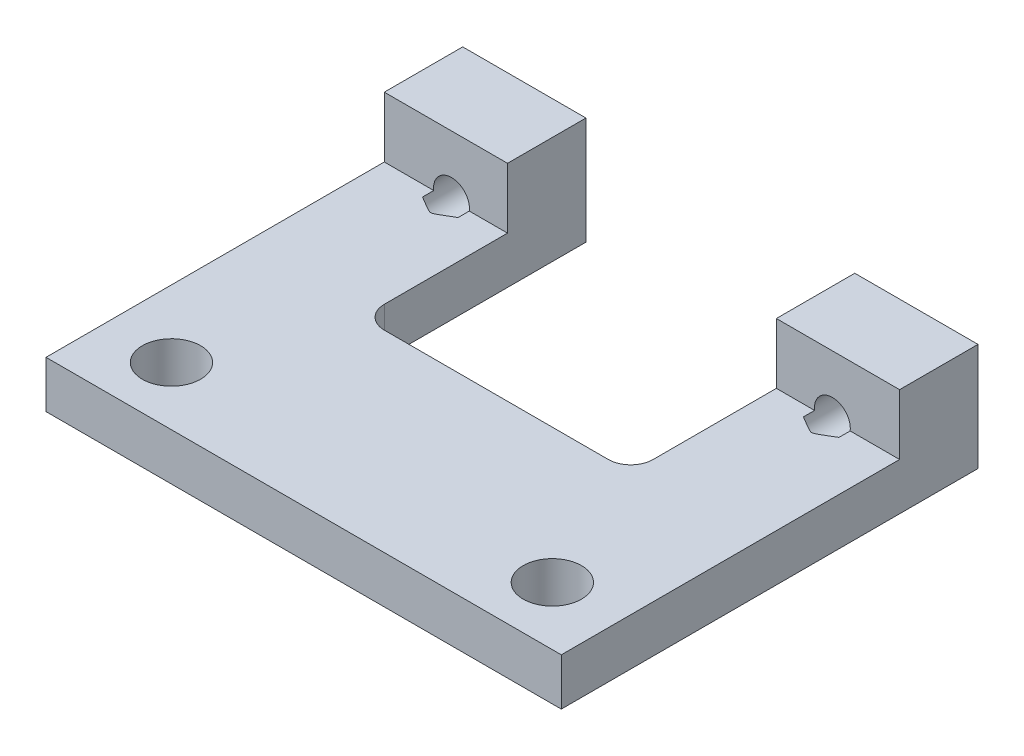
from build123d import *

# Parameters (mm, degrees)
SKETCH1_W                 = 23
SKETCH1_H                 = 18.6
BOSS_EXTRUDE1_DEPTH       = 4.8
SKETCH2_W                 = 15.1
SKETCH2_H                 = 2.7
CUT_EXTRUDE1_DEPTH        = 27.8
SKETCH3_W                 = 12
SKETCH3_H                 = 10
CUT_EXTRUDE2_DEPTH        = 27.8
M2X0_4_TAPPED_HOLE1_D     = 1.6
M2X0_4_TAPPED_HOLE1_DEPTH = 4
M2X0_4_TAPPED_HOLE1_TIP   = 0.480688495
SKETCH7_R                 = 1.3
CUT_EXTRUDE3_DEPTH        = 27.8
FILLET1_R                 = 1


with BuildPart() as part:
    # Sketch1 → Boss-Extrude1 (new body)
    with BuildSketch(Plane(origin=(0, 0, 0), x_dir=(1, 0, 0), z_dir=(0, 1, 0))):
        Rectangle(SKETCH1_W, SKETCH1_H)
    extrude(amount=BOSS_EXTRUDE1_DEPTH)

    # Sketch2 → Cut-Extrude1 (cut)
    with BuildSketch(Plane(origin=(11.5, 0, 0), x_dir=(0, 0, -1), z_dir=(1, 0, 0))):
        with Locations((-1.75, 3.45)):
            Rectangle(SKETCH2_W, SKETCH2_H)
    extrude(amount=-CUT_EXTRUDE1_DEPTH, mode=Mode.SUBTRACT)

    # Sketch3 → Cut-Extrude2 (cut)
    with BuildSketch(Plane.XZ):
        with Locations((0, -4.3)):
            Rectangle(SKETCH3_W, SKETCH3_H)
    extrude(amount=-CUT_EXTRUDE2_DEPTH, mode=Mode.SUBTRACT)

    # M2x0.4 Tapped Hole1
    with Locations(Plane(origin=(0, 0, -9.3), x_dir=(-1, 0, 0), z_dir=(0, 0, -1))):
        with Locations((-8.5, 2.2), (8.5, 2.2)):
            Hole(M2X0_4_TAPPED_HOLE1_D / 2, depth=M2X0_4_TAPPED_HOLE1_DEPTH)
            with Locations((0, 0, -(M2X0_4_TAPPED_HOLE1_DEPTH + M2X0_4_TAPPED_HOLE1_TIP / 2))):  # 118° drill point
                Cone(0, M2X0_4_TAPPED_HOLE1_D / 2, M2X0_4_TAPPED_HOLE1_TIP, mode=Mode.SUBTRACT)

    # Sketch7 → Cut-Extrude3 (cut)
    with BuildSketch(Plane.XZ):
        with Locations((-8.5, 6.7)):
            Circle(SKETCH7_R)
        with Locations((8.5, 6.7)):
            Circle(SKETCH7_R)
    extrude(amount=-CUT_EXTRUDE3_DEPTH, mode=Mode.SUBTRACT)

    # Fillet1
    fillet1_edges = [part.edges().sort_by_distance(p)[0] for p in [
        (6, 1.05, 0.7),
        (-6, 1.05, 0.7),
    ]]
    fillet(fillet1_edges, radius=FILLET1_R)


solid = part.part
